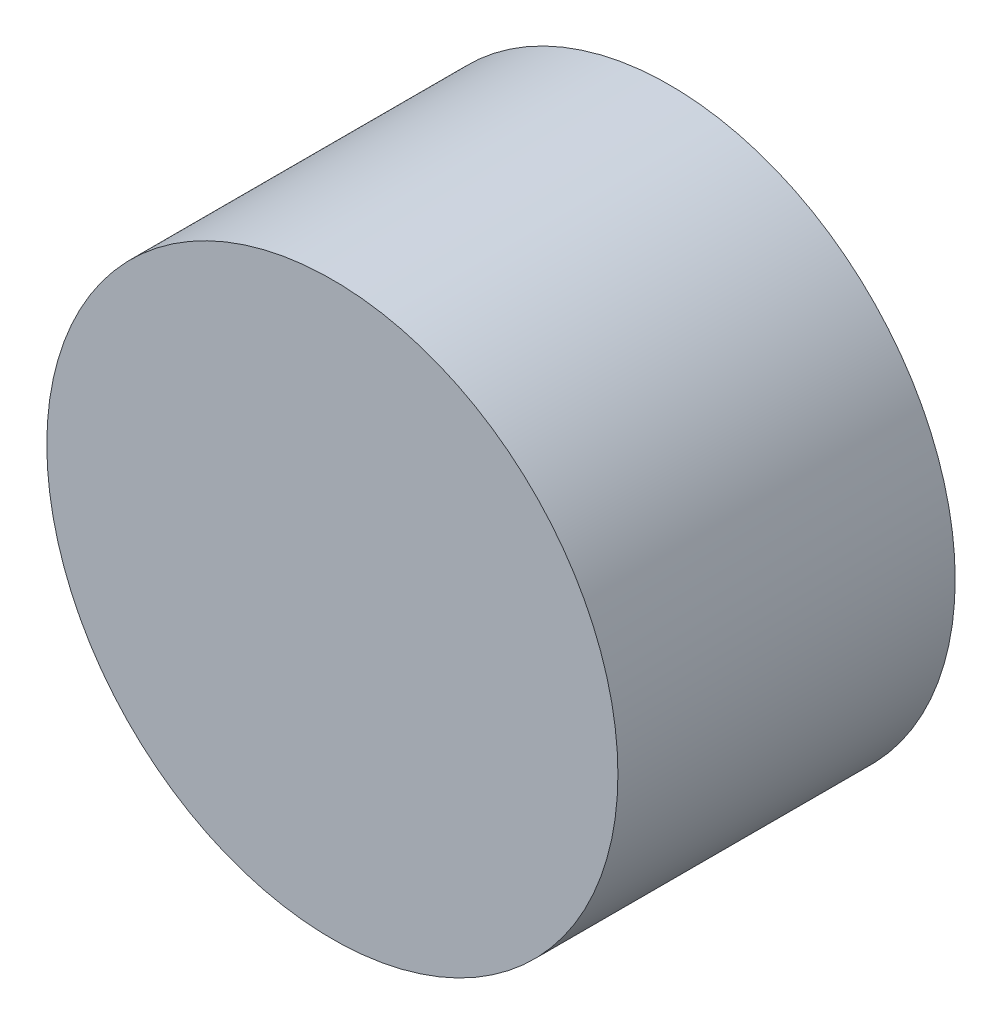
from build123d import *

# Parameters (mm, degrees)
SKETCH1_R           = 25.4
BOSS_EXTRUDE1_DEPTH = 30


with BuildPart() as part:
    # Sketch1 → Boss-Extrude1 (new body)
    with BuildSketch(Plane.XY):
        Circle(SKETCH1_R)
    extrude(amount=BOSS_EXTRUDE1_DEPTH)


solid = part.part
